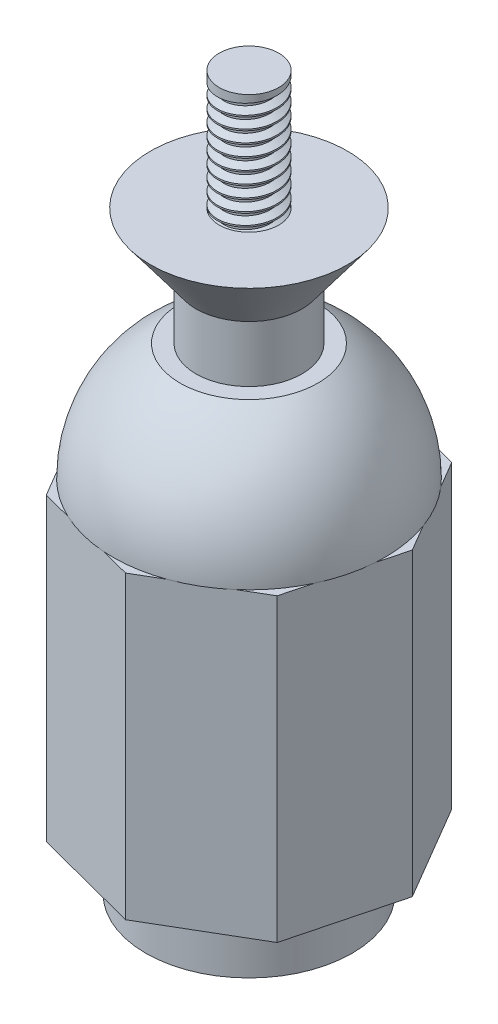
from build123d import *

# Parameters (mm, degrees)
SKETCH1_R               = 11
BOSS_EXTRUDE1_DEPTH     = 6.3
BOSS_EXTRUDE2_DEPTH     = 32
CUT_EXTRUDE1_DEPTH      = 32
CUT_EXTRUDE1_DEPTH_BACK = 32
SKETCH4_W               = 30.684168356
SKETCH4_H               = 3
SKETCH5_R               = 5.65
BOSS_EXTRUDE3_DEPTH     = 6
SKETCH7_R               = 3.175
BOSS_EXTRUDE4_DEPTH     = 12.7
SKETCH8_R               = 3.175
CUT_EXTRUDE2_DEPTH      = 17.78
THREAD1_PITCH           = 1.27
THREAD2_PITCH           = 1.27


with BuildPart() as part:
    # Sketch1 → Boss-Extrude1 (new body)
    with BuildSketch(Plane(origin=(0, 0, 0), x_dir=(1, 0, 0), z_dir=(0, 1, 0))):
        with Locations(Location((0, 0, 0), (0, 0, 270))):
            Circle(SKETCH1_R)
    extrude(amount=BOSS_EXTRUDE1_DEPTH)

    # Sketch2 → Boss-Extrude2 (add)
    with BuildSketch(Plane(origin=(0, 6.3, 0), x_dir=(1, 0, 0), z_dir=(0, 1, 0))):
        Polygon((-2.125255952, 15.27696973), (-12.305231787, 9.299665997), (-15.27696973, -2.125255952), (-9.299665997, -12.305231787), (2.125255952, -15.27696973), (12.305231787, -9.299665997), (15.27696973, 2.125255952), (9.299665997, 12.305231787), align=None)
    extrude(amount=BOSS_EXTRUDE2_DEPTH)

    # Sketch3 → Revolve2 (revolve)
    with BuildSketch(Plane.XY, mode=Mode.PRIVATE) as revolve2_sk:
        with BuildLine():
            Line((0, 52.8), (0, 38.3))
            Line((0, 38.3), (-14.5, 38.3))
            ThreePointArc((-14.5, 38.3), (-10.253048327, 48.553048327), (0, 52.8))
        make_face()
    revolve(revolve2_sk.sketch.rotate(Axis((0, 52.8, 0), (0, -1, 0)), 180), axis=Axis((0, 52.8, 0), (0, -1, 0)))

    # Sketch4 → Cut-Extrude1 (cut, two sides: drawn at the far end of the back side and taken through both)
    with BuildSketch(Plane.XY.offset(-CUT_EXTRUDE1_DEPTH_BACK)):
        with Locations((0.162901884, 52.3)):
            Rectangle(SKETCH4_W, SKETCH4_H)
    extrude(amount=CUT_EXTRUDE1_DEPTH + CUT_EXTRUDE1_DEPTH_BACK, mode=Mode.SUBTRACT)

    # Sketch5 → Boss-Extrude3 (add)
    with BuildSketch(Plane(origin=(0, 50.8, 0), x_dir=(1, 0, 0), z_dir=(0, 1, 0))):
        with Locations(Location((0, 0, 0), (0, 0, 270))):
            Circle(SKETCH5_R)
    extrude(amount=BOSS_EXTRUDE3_DEPTH)

    # Sketch6 → Revolve3 (revolve)
    with BuildSketch(Plane(origin=(0, 0, 0), x_dir=(0, 0, -1), z_dir=(1, 0, 0)), mode=Mode.PRIVATE) as revolve3_sk:
        Polygon((0, 63.3), (0, 56.8), (5.65, 56.8), (10.5, 63.3), align=None)
    revolve(revolve3_sk.sketch.rotate(Axis((0, 63.3, 0), (0, -1, 0)), 93.925221038), axis=Axis((0, 63.3, 0), (0, -1, 0)))

    # Sketch7 → Boss-Extrude4 (add)
    with BuildSketch(Plane(origin=(0, 63.3, 0), x_dir=(1, 0, 0), z_dir=(0, 1, 0))):
        with Locations(Location((0, 0, 0), (0, 0, 270))):
            Circle(SKETCH7_R)
    extrude(amount=BOSS_EXTRUDE4_DEPTH)

    # Sketch8 → Cut-Extrude2 (cut)
    with BuildSketch(Plane(origin=(0, 0, 0), x_dir=(-1, 0, 0), z_dir=(0, -1, 0))):
        with Locations(Location((0, 0, 0), (0, 0, 270))):
            Circle(SKETCH8_R)
    extrude(amount=-CUT_EXTRUDE2_DEPTH, mode=Mode.SUBTRACT)

    # Thread1: the profile of Thread Profile1 profile screwed along a right-hand helix of 14 turns, 8 arcs to a turn; built about Z, then put on its axis
    thread1_z = Axis((0, 0, 0), (0, 0, 1))
    thread1_corners = [(3.1753, 0, -0.000173205), (3.1753, 0, 1.111423202), (2.487592339, 0, 0.714374998), (2.487592339, 0, 0.396874998)]
    with BuildLine(mode=Mode.PRIVATE) as thread1_profile:
        Line(thread1_corners[0], thread1_corners[1])
        Line(thread1_corners[1], thread1_corners[2])
        Line(thread1_corners[2], thread1_corners[3])
        Line(thread1_corners[3], thread1_corners[0])
    thread1_cap = Face(thread1_profile.wire())
    thread1_turn_angles = [0, 22.5, 45, 67.5, 90, 112.5, 135, 157.5, 180, 202.5, 225, 247.5, 270, 292.5, 315, 337.5, 360]
    thread1_turn_weights = [1, 0.9238795325112867, 1, 0.9238795325112867, 1, 0.9238795325112867, 1, 0.9238795325112867, 1, 0.9238795325112867, 1, 0.9238795325112867, 1, 0.9238795325112867, 1, 0.9238795325112867, 1]
    thread1_turn_rails = [Edge.make_bspline([Vector(p[0], p[1], 0).rotate(thread1_z, thread1_turn_angles[k]) / thread1_turn_weights[k] + Vector(0, 0, p[2] + THREAD1_PITCH * thread1_turn_angles[k] / 360) for k in range(17)], [0, 0, 0, 1, 1, 2, 2, 3, 3, 4, 4, 5, 5, 6, 6, 7, 7, 8, 8, 8], 2, thread1_turn_weights) for p in thread1_corners]
    thread1_turn_sides = [Face.make_surface_from_curves(thread1_turn_rails[p[0]], thread1_turn_rails[p[1]]) for p in [(0, 1), (1, 2), (2, 3), (3, 0)]]
    thread1 = Plane(origin=(0, 0, 0), x_dir=(1, 0, 0), z_dir=(0, 1, 0)) * Solid(Shell([*[p.moved(Location((0, 0, THREAD1_PITCH * i))) for i in range(14) for p in thread1_turn_sides], thread1_cap, thread1_cap.rotate(thread1_z, 5040).moved(Location((0, 0, THREAD1_PITCH * 5040 / 360)))]))
    add(thread1)

    # Thread2: the profile of Thread Profile2 profile screwed along a right-hand helix of 10 turns, 8 arcs to a turn; built about Z, then put on its axis
    thread2_z = Axis((0, 0, 0), (0, 0, 1))
    thread2_corners = [(3.1753, 0, -0.000173205), (3.1753, 0, 1.111423202), (2.487592339, 0, 0.714374998), (2.487592339, 0, 0.396874998)]
    with BuildLine(mode=Mode.PRIVATE) as thread2_profile:
        Line(thread2_corners[0], thread2_corners[1])
        Line(thread2_corners[1], thread2_corners[2])
        Line(thread2_corners[2], thread2_corners[3])
        Line(thread2_corners[3], thread2_corners[0])
    thread2_cap = Face(thread2_profile.wire())
    thread2_turn_angles = [0, 22.5, 45, 67.5, 90, 112.5, 135, 157.5, 180, 202.5, 225, 247.5, 270, 292.5, 315, 337.5, 360]
    thread2_turn_weights = [1, 0.9238795325112867, 1, 0.9238795325112867, 1, 0.9238795325112867, 1, 0.9238795325112867, 1, 0.9238795325112867, 1, 0.9238795325112867, 1, 0.9238795325112867, 1, 0.9238795325112867, 1]
    thread2_turn_rails = [Edge.make_bspline([Vector(p[0], p[1], 0).rotate(thread2_z, thread2_turn_angles[k]) / thread2_turn_weights[k] + Vector(0, 0, p[2] + THREAD2_PITCH * thread2_turn_angles[k] / 360) for k in range(17)], [0, 0, 0, 1, 1, 2, 2, 3, 3, 4, 4, 5, 5, 6, 6, 7, 7, 8, 8, 8], 2, thread2_turn_weights) for p in thread2_corners]
    thread2_turn_sides = [Face.make_surface_from_curves(thread2_turn_rails[p[0]], thread2_turn_rails[p[1]]) for p in [(0, 1), (1, 2), (2, 3), (3, 0)]]
    thread2 = Plane(origin=(0, 76, 0), x_dir=(-1, 0, 0), z_dir=(0, -1, 0)) * Solid(Shell([*[p.moved(Location((0, 0, THREAD2_PITCH * i))) for i in range(10) for p in thread2_turn_sides], thread2_cap, thread2_cap.rotate(thread2_z, 3600).moved(Location((0, 0, THREAD2_PITCH * 3600 / 360)))]))
    add(thread2, mode=Mode.SUBTRACT)


solid = part.part
